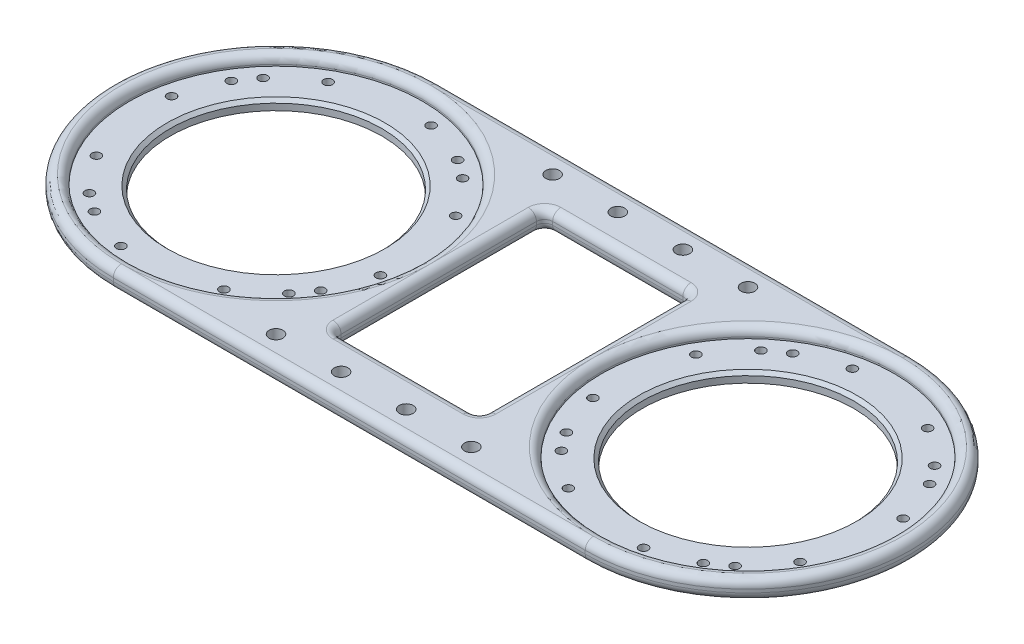
from build123d import *

# Parameters (mm, degrees)
EXTRUDE_1_DEPTH      = 6
EXTRUDE_1_DEPTH_BACK = 6
CUT_EXTRUDE_1_REACH  = 266.69
SKETCH_3_R           = 2.75
FILLET_1_R           = 5
FILLET_2_R           = 5
CHAMFER_1_SIZE       = 2
SKETCH_11_W          = 90
SKETCH_11_H          = 130
CUT_EXTRUDE_6_DEPTH  = 47
FILLET_8_R           = 5
SKETCH_12_R          = 4.25
CUT_EXTRUDE_7_DEPTH  = 47


with BuildPart() as part:
    # 草图1 → 凸台-拉伸1 (new, two sides: drawn at the far end of the back side and taken through both)
    with BuildSketch(Plane(origin=(0, 0, 0), x_dir=(1, 0, 0), z_dir=(0, 1, 0)).offset(-EXTRUDE_1_DEPTH_BACK)):
        with BuildLine():
            Line((-145, 100), (145, 100))
            ThreePointArc((145, 100), (245, 0), (145, -100))
            Line((145, -100), (-145, -100))
            ThreePointArc((-145, -100), (-245, 0), (-145, 100))
        make_face()
    extrude(amount=EXTRUDE_1_DEPTH + EXTRUDE_1_DEPTH_BACK)

    # 草图2 → 切除-旋转1 (revolve, cut)
    with BuildSketch(Plane.XY, mode=Mode.PRIVATE) as cut_revolve_1_sk:
        Polygon((-145, -6), (-80, -6), (-80, 0), (-55, 0), (-55, 6), (-145, 6), align=None)
    cut_revolve_1 = revolve(cut_revolve_1_sk.sketch.rotate(Axis((-145, 6, 0), (0, -1, 0)), 90), axis=Axis((-145, 6, 0), (0, -1, 0)), mode=Mode.SUBTRACT)

    # 草图3 → 切除-拉伸1 (cut, up to next)
    with BuildSketch(Plane(origin=(0, 0, 0), x_dir=(1, 0, 0), z_dir=(0, 1, 0)), mode=Mode.PRIVATE) as cut_extrude_1_sk1:
        with Locations(Location((-102.948449102, 69.52143243, 0), (0, 0, 270))):
            Circle(SKETCH_3_R)
    cut_extrude_1_tool1 = extrude(cut_extrude_1_sk1.sketch, amount=-CUT_EXTRUDE_1_REACH, mode=Mode.PRIVATE) & part.part
    # 草图3 → 切除-拉伸1 (cut, up to next)
    with BuildSketch(Plane(origin=(0, 0, 0), x_dir=(1, 0, 0), z_dir=(0, 1, 0)), mode=Mode.PRIVATE) as cut_extrude_1_sk2:
        with Locations(Location((-91.648002637, 61.27909005, 0), (0, 0, 270))):
            Circle(SKETCH_3_R)
    cut_extrude_1_tool2 = extrude(cut_extrude_1_sk2.sketch, amount=-CUT_EXTRUDE_1_REACH, mode=Mode.PRIVATE) & part.part
    # 草图3 → 切除-拉伸1 (cut, up to next)
    with BuildSketch(Plane(origin=(0, 0, 0), x_dir=(1, 0, 0), z_dir=(0, 1, 0)), mode=Mode.PRIVATE) as cut_extrude_1_sk3:
        with Locations(Location((-73.821572439, 39.181551143, 0), (0, 0, 270))):
            Circle(SKETCH_3_R)
    cut_extrude_1_tool3 = extrude(cut_extrude_1_sk3.sketch, amount=-CUT_EXTRUDE_1_REACH, mode=Mode.PRIVATE) & part.part
    # 草图3 → 切除-拉伸1 (cut, up to next)
    with BuildSketch(Plane(origin=(0, 0, 0), x_dir=(1, 0, 0), z_dir=(0, 1, 0)), mode=Mode.PRIVATE) as cut_extrude_1_sk4:
        with Locations(Location((-129.435359966, 79.745247386, 0), (0, 0, 270))):
            Circle(SKETCH_3_R)
    cut_extrude_1_tool4 = extrude(cut_extrude_1_sk4.sketch, amount=-CUT_EXTRUDE_1_REACH, mode=Mode.PRIVATE) & part.part
    # 草图3 → 切除-拉伸1 (cut, up to next)
    with BuildSketch(Plane(origin=(0, 0, 0), x_dir=(1, 0, 0), z_dir=(0, 1, 0)), mode=Mode.PRIVATE) as cut_extrude_1_sk5:
        with Locations(Location((-75.47856757, -42.051550898, 0), (0, 0, 270))):
            Circle(SKETCH_3_R)
    cut_extrude_1_tool5 = extrude(cut_extrude_1_sk5.sketch, amount=-CUT_EXTRUDE_1_REACH, mode=Mode.PRIVATE) & part.part
    # 草图3 → 切除-拉伸1 (cut, up to next)
    with BuildSketch(Plane(origin=(0, 0, 0), x_dir=(1, 0, 0), z_dir=(0, 1, 0)), mode=Mode.PRIVATE) as cut_extrude_1_sk6:
        with Locations(Location((-83.72090995, -53.351997363, 0), (0, 0, 270))):
            Circle(SKETCH_3_R)
    cut_extrude_1_tool6 = extrude(cut_extrude_1_sk6.sketch, amount=-CUT_EXTRUDE_1_REACH, mode=Mode.PRIVATE) & part.part
    # 草图3 → 切除-拉伸1 (cut, up to next)
    with BuildSketch(Plane(origin=(0, 0, 0), x_dir=(1, 0, 0), z_dir=(0, 1, 0)), mode=Mode.PRIVATE) as cut_extrude_1_sk7:
        with Locations(Location((-105.818448857, -71.178427561, 0), (0, 0, 270))):
            Circle(SKETCH_3_R)
    cut_extrude_1_tool7 = extrude(cut_extrude_1_sk7.sketch, amount=-CUT_EXTRUDE_1_REACH, mode=Mode.PRIVATE) & part.part
    # 草图3 → 切除-拉伸1 (cut, up to next)
    with BuildSketch(Plane(origin=(0, 0, 0), x_dir=(1, 0, 0), z_dir=(0, 1, 0)), mode=Mode.PRIVATE) as cut_extrude_1_sk8:
        with Locations(Location((-65.254752614, -15.564640034, 0), (0, 0, 270))):
            Circle(SKETCH_3_R)
    cut_extrude_1_tool8 = extrude(cut_extrude_1_sk8.sketch, amount=-CUT_EXTRUDE_1_REACH, mode=Mode.PRIVATE) & part.part
    # 草图3 → 切除-拉伸1 (cut, up to next)
    with BuildSketch(Plane(origin=(0, 0, 0), x_dir=(1, 0, 0), z_dir=(0, 1, 0)), mode=Mode.PRIVATE) as cut_extrude_1_sk9:
        with Locations(Location((-187.051550898, -69.52143243, 0), (0, 0, 270))):
            Circle(SKETCH_3_R)
    cut_extrude_1_tool9 = extrude(cut_extrude_1_sk9.sketch, amount=-CUT_EXTRUDE_1_REACH, mode=Mode.PRIVATE) & part.part
    # 草图3 → 切除-拉伸1 (cut, up to next)
    with BuildSketch(Plane(origin=(0, 0, 0), x_dir=(1, 0, 0), z_dir=(0, 1, 0)), mode=Mode.PRIVATE) as cut_extrude_1_sk10:
        with Locations(Location((-198.351997363, -61.27909005, 0), (0, 0, 270))):
            Circle(SKETCH_3_R)
    cut_extrude_1_tool10 = extrude(cut_extrude_1_sk10.sketch, amount=-CUT_EXTRUDE_1_REACH, mode=Mode.PRIVATE) & part.part
    # 草图3 → 切除-拉伸1 (cut, up to next)
    with BuildSketch(Plane(origin=(0, 0, 0), x_dir=(1, 0, 0), z_dir=(0, 1, 0)), mode=Mode.PRIVATE) as cut_extrude_1_sk11:
        with Locations(Location((-216.178427561, -39.181551143, 0), (0, 0, 270))):
            Circle(SKETCH_3_R)
    cut_extrude_1_tool11 = extrude(cut_extrude_1_sk11.sketch, amount=-CUT_EXTRUDE_1_REACH, mode=Mode.PRIVATE) & part.part
    # 草图3 → 切除-拉伸1 (cut, up to next)
    with BuildSketch(Plane(origin=(0, 0, 0), x_dir=(1, 0, 0), z_dir=(0, 1, 0)), mode=Mode.PRIVATE) as cut_extrude_1_sk12:
        with Locations(Location((-160.564640034, -79.745247386, 0), (0, 0, 270))):
            Circle(SKETCH_3_R)
    cut_extrude_1_tool12 = extrude(cut_extrude_1_sk12.sketch, amount=-CUT_EXTRUDE_1_REACH, mode=Mode.PRIVATE) & part.part
    # 草图3 → 切除-拉伸1 (cut, up to next)
    with BuildSketch(Plane(origin=(0, 0, 0), x_dir=(1, 0, 0), z_dir=(0, 1, 0)), mode=Mode.PRIVATE) as cut_extrude_1_sk13:
        with Locations(Location((-214.52143243, 42.051550898, 0), (0, 0, 270))):
            Circle(SKETCH_3_R)
    cut_extrude_1_tool13 = extrude(cut_extrude_1_sk13.sketch, amount=-CUT_EXTRUDE_1_REACH, mode=Mode.PRIVATE) & part.part
    # 草图3 → 切除-拉伸1 (cut, up to next)
    with BuildSketch(Plane(origin=(0, 0, 0), x_dir=(1, 0, 0), z_dir=(0, 1, 0)), mode=Mode.PRIVATE) as cut_extrude_1_sk14:
        with Locations(Location((-206.27909005, 53.351997363, 0), (0, 0, 270))):
            Circle(SKETCH_3_R)
    cut_extrude_1_tool14 = extrude(cut_extrude_1_sk14.sketch, amount=-CUT_EXTRUDE_1_REACH, mode=Mode.PRIVATE) & part.part
    # 草图3 → 切除-拉伸1 (cut, up to next)
    with BuildSketch(Plane(origin=(0, 0, 0), x_dir=(1, 0, 0), z_dir=(0, 1, 0)), mode=Mode.PRIVATE) as cut_extrude_1_sk15:
        with Locations(Location((-184.181551143, 71.178427561, 0), (0, 0, 270))):
            Circle(SKETCH_3_R)
    cut_extrude_1_tool15 = extrude(cut_extrude_1_sk15.sketch, amount=-CUT_EXTRUDE_1_REACH, mode=Mode.PRIVATE) & part.part
    # 草图3 → 切除-拉伸1 (cut, up to next)
    with BuildSketch(Plane(origin=(0, 0, 0), x_dir=(1, 0, 0), z_dir=(0, 1, 0)), mode=Mode.PRIVATE) as cut_extrude_1_sk16:
        with Locations(Location((-224.745247386, 15.564640034, 0), (0, 0, 270))):
            Circle(SKETCH_3_R)
    cut_extrude_1_tool16 = extrude(cut_extrude_1_sk16.sketch, amount=-CUT_EXTRUDE_1_REACH, mode=Mode.PRIVATE) & part.part
    cut_extrude_1_1 = cut_extrude_1_tool1.solids().sort_by_distance((-102.948449, 0, -69.521432))[0]
    add(cut_extrude_1_1, mode=Mode.SUBTRACT)
    cut_extrude_1_2 = cut_extrude_1_tool2.solids().sort_by_distance((-91.648003, 0, -61.27909))[0]
    add(cut_extrude_1_2, mode=Mode.SUBTRACT)
    cut_extrude_1_3 = cut_extrude_1_tool3.solids().sort_by_distance((-73.821572, 0, -39.181551))[0]
    add(cut_extrude_1_3, mode=Mode.SUBTRACT)
    cut_extrude_1_4 = cut_extrude_1_tool4.solids().sort_by_distance((-129.43536, 0, -79.745247))[0]
    add(cut_extrude_1_4, mode=Mode.SUBTRACT)
    cut_extrude_1_5 = cut_extrude_1_tool5.solids().sort_by_distance((-75.478568, 0, 42.051551))[0]
    add(cut_extrude_1_5, mode=Mode.SUBTRACT)
    cut_extrude_1_6 = cut_extrude_1_tool6.solids().sort_by_distance((-83.72091, 0, 53.351997))[0]
    add(cut_extrude_1_6, mode=Mode.SUBTRACT)
    cut_extrude_1_7 = cut_extrude_1_tool7.solids().sort_by_distance((-105.818449, 0, 71.178428))[0]
    add(cut_extrude_1_7, mode=Mode.SUBTRACT)
    cut_extrude_1_8 = cut_extrude_1_tool8.solids().sort_by_distance((-65.254753, 0, 15.56464))[0]
    add(cut_extrude_1_8, mode=Mode.SUBTRACT)
    cut_extrude_1_9 = cut_extrude_1_tool9.solids().sort_by_distance((-187.051551, 0, 69.521432))[0]
    add(cut_extrude_1_9, mode=Mode.SUBTRACT)
    cut_extrude_1_10 = cut_extrude_1_tool10.solids().sort_by_distance((-198.351997, 0, 61.27909))[0]
    add(cut_extrude_1_10, mode=Mode.SUBTRACT)
    cut_extrude_1_11 = cut_extrude_1_tool11.solids().sort_by_distance((-216.178428, 0, 39.181551))[0]
    add(cut_extrude_1_11, mode=Mode.SUBTRACT)
    cut_extrude_1_12 = cut_extrude_1_tool12.solids().sort_by_distance((-160.56464, 0, 79.745247))[0]
    add(cut_extrude_1_12, mode=Mode.SUBTRACT)
    cut_extrude_1_13 = cut_extrude_1_tool13.solids().sort_by_distance((-214.521432, 0, -42.051551))[0]
    add(cut_extrude_1_13, mode=Mode.SUBTRACT)
    cut_extrude_1_14 = cut_extrude_1_tool14.solids().sort_by_distance((-206.27909, 0, -53.351997))[0]
    add(cut_extrude_1_14, mode=Mode.SUBTRACT)
    cut_extrude_1_15 = cut_extrude_1_tool15.solids().sort_by_distance((-184.181551, 0, -71.178428))[0]
    add(cut_extrude_1_15, mode=Mode.SUBTRACT)
    cut_extrude_1_16 = cut_extrude_1_tool16.solids().sort_by_distance((-224.745247, 0, -15.56464))[0]
    add(cut_extrude_1_16, mode=Mode.SUBTRACT)
    cut_extrude_1 = cut_extrude_1_1 + cut_extrude_1_2 + cut_extrude_1_3 + cut_extrude_1_4 + cut_extrude_1_5 + cut_extrude_1_6 + cut_extrude_1_7 + cut_extrude_1_8 + cut_extrude_1_9 + cut_extrude_1_10 + cut_extrude_1_11 + cut_extrude_1_12 + cut_extrude_1_13 + cut_extrude_1_14 + cut_extrude_1_15 + cut_extrude_1_16  # 切除-拉伸1 as one shape, for the pattern or mirror that repeats it

    # 镜向1: 切除-旋转1, 切除-拉伸1 across plane
    add(cut_revolve_1.mirror(Plane(origin=(0, 0, 0), x_dir=(0, 0, 1), z_dir=(1, 0, 0))), mode=Mode.SUBTRACT)
    add(cut_extrude_1.mirror(Plane(origin=(0, 0, 0), x_dir=(0, 0, 1), z_dir=(1, 0, 0))), mode=Mode.SUBTRACT)

    # 圆角1
    fillet_1_edges = [part.edges().sort_by_distance(p)[0] for p in [
        (245, -6, 0),
        (0, -6, -100),
        (-245, -6, 0),
        (0, -6, 100),
    ]]
    fillet(fillet_1_edges, radius=FILLET_1_R)

    # 圆角2
    fillet_2_edges = [part.edges().sort_by_distance(p)[0] for p in [
        (-245, 6, 0),
        (0, 6, 100),
        (245, 6, 0),
        (0, 6, -100),
        (-145, 6, -90),
        (145, 6, -90),
    ]]
    fillet(fillet_2_edges, radius=FILLET_2_R - 0.0001)  # a hair under: the kernel refuses the full size

    # 倒角1
    chamfer_1_edges = [part.edges().sort_by_distance(p)[0] for p in [
        (-145, 0, -65),
        (145, 0, -65),
    ]]
    chamfer(chamfer_1_edges, length=CHAMFER_1_SIZE)

    # 草图11 → 切除-拉伸6 (cut)
    with BuildSketch(Plane(origin=(0, 6, 0), x_dir=(1, 0, 0), z_dir=(0, 1, 0))):
        Rectangle(SKETCH_11_W, SKETCH_11_H)
    extrude(amount=-CUT_EXTRUDE_6_DEPTH, mode=Mode.SUBTRACT)

    # 圆角8
    fillet_8_edges = [part.edges().sort_by_distance(p)[0] for p in [
        (-45, -6, 0),
        (-45, 0, 65),
        (0, -6, -65),
        (-45, 0, -65),
        (45, -6, 0),
        (45, 0, -65),
        (0, -6, 65),
        (45, 0, 65),
        (-45, 6, 0),
        (0, 6, 65),
        (45, 6, 0),
        (0, 6, -65),
    ]]
    fillet(fillet_8_edges, radius=FILLET_8_R)

    # 草图12 → 切除-拉伸7 (cut)
    with BuildSketch(Plane(origin=(0, 6, 0), x_dir=(1, 0, 0), z_dir=(0, 1, 0))):
        with Locations(Location((60, -85, 0), (0, 0, 270))):
            Circle(SKETCH_12_R)
        with Locations(Location((20, -85, 0), (0, 0, 270))):
            Circle(SKETCH_12_R)
        with Locations(Location((-20, -85, 0), (0, 0, 270))):
            Circle(SKETCH_12_R)
        with Locations(Location((-60, -85, 0), (0, 0, 270))):
            Circle(SKETCH_12_R)
        with Locations(Location((20, 85, 0), (0, 0, 270))):
            Circle(SKETCH_12_R)
        with Locations(Location((60, 85, 0), (0, 0, 270))):
            Circle(SKETCH_12_R)
        with Locations(Location((-60, 85, 0), (0, 0, 270))):
            Circle(SKETCH_12_R)
        with Locations(Location((-20, 85, 0), (0, 0, 270))):
            Circle(SKETCH_12_R)
    extrude(amount=-CUT_EXTRUDE_7_DEPTH, mode=Mode.SUBTRACT)


solid = part.part
